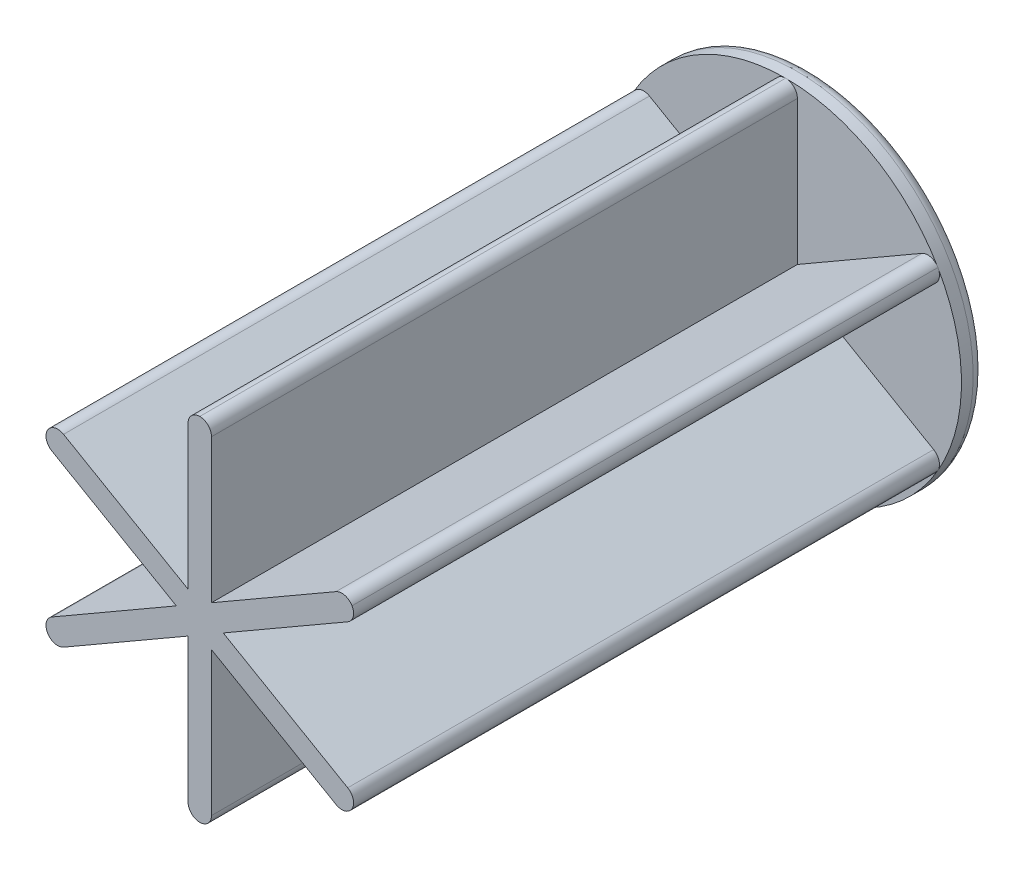
from build123d import *
from build123d.topology import SkipClean

# Parameters (mm, degrees)
SKETCH1_R           = 15
BOSS_EXTRUDE1_DEPTH = 2
BOSS_EXTRUDE2_DEPTH = 50
CIRPATTERN1_COUNT   = 3
CIRPATTERN1_ANGLE   = 120
CUT_EXTRUDE1_DEPTH  = 10
FILLET2_R           = 1
FILLET3_R           = 1


with BuildPart() as part:
    # Sketch1 → Boss-Extrude1 (new body)
    with BuildSketch(Plane.XY):
        Circle(SKETCH1_R)
    extrude(amount=BOSS_EXTRUDE1_DEPTH)

    # Sketch2 → Boss-Extrude2 (add)
    with SkipClean():  # the faces are left unmerged after this step: merging them gives an invalid solid
        with BuildSketch(Plane.XY.offset(2)):
            with BuildLine():
                Line((-1, -14.966629547), (-1, 14.966629547))
                ThreePointArc((-1, 14.966629547), (0, 15), (1, 14.966629547))
                Line((1, 14.966629547), (1, -14.966629547))
                ThreePointArc((1, -14.966629547), (0, -15), (-1, -14.966629547))
            make_face()
        boss_extrude2 = extrude(amount=BOSS_EXTRUDE2_DEPTH)

    # CirPattern1: Boss-Extrude2 ×3 about axis
    with SkipClean():  # the faces are left unmerged after this step: merging them gives an invalid solid
        cirpattern1_axis = Axis((0, 0, 0), (0, 0, 1))
        for i in range(1, CIRPATTERN1_COUNT):
            add(boss_extrude2.rotate(cirpattern1_axis, i * CIRPATTERN1_ANGLE / (CIRPATTERN1_COUNT - 1)))

    # Sketch3 → Cut-Extrude1 (cut)
    with SkipClean():  # the faces are left unmerged after this step: merging them gives an invalid solid
        with BuildSketch(Plane(origin=(0, 0, 0), x_dir=(-1, 0, 0), z_dir=(0, 0, -1))):
            with BuildLine():
                Line((-2.598076211, 1.5), (2.598076211, 1.5))
                ThreePointArc((2.598076211, 1.5), (0, -3), (-2.598076211, 1.5))
            make_face()
        extrude(amount=-CUT_EXTRUDE1_DEPTH, mode=Mode.SUBTRACT)

    # Fillet2
    # the kernel refuses this fillet: 1 mm, written as the material it takes off along each edge
    with BuildSketch(Plane(origin=(12.461481397, 8.349340177, 2), x_dir=(0.5286054177499072, -0.8488676647896573, 0), z_dir=(0, 0, 1)), Plane(origin=(-12.461481397, -8.349340177, 2), x_dir=(-0.5286054177499102, 0.8488676647896556, 0), z_dir=(0, 0, 1)), Plane(origin=(-13.461481397, 6.61728937, 2), x_dir=(0.4708382532840629, 0.882219552744334, 0), z_dir=(0, 0, 1)), Plane(origin=(13.461481397, -6.61728937, 2), x_dir=(-0.47083825328406437, -0.8822195527443331, 0), z_dir=(0, 0, 1)), Plane(origin=(-1, 14.966629547, 2), x_dir=(0.9994436710339702, 0.03335188795467453, 0), z_dir=(0, 0, 1)), Plane(origin=(1, -14.966629547, 2), x_dir=(-0.9994436710339702, -0.03335188795467453, 0), z_dir=(0, 0, 1))) as fillet2_piece_1:
        with BuildLine():
            CenterArc((0.967204751, -0.999443671), FILLET2_R, 88.088723135, 90)
            Line((-0.03223892, -0.966091783), (0, 0))
            ThreePointArc((0, 0), (0.500278319, 0.008344934), (1.000556639, 0))
        make_face()
    extrude(amount=52.501391597, mode=Mode.SUBTRACT)
    with BuildSketch(Plane(origin=(-12.461481397, 8.349340177, 2), x_dir=(-0.5286054177498939, -0.8488676647896658, 0), z_dir=(0, 0, 1)), Plane(origin=(12.461481397, -8.349340177, 2), x_dir=(0.52860541774991, 0.8488676647896555, 0), z_dir=(0, 0, 1)), Plane(origin=(13.461481397, 6.61728937, 2), x_dir=(-0.4708382532840634, 0.8822195527443337, 0), z_dir=(0, 0, 1)), Plane(origin=(-13.461481397, -6.61728937, 2), x_dir=(0.470838253284063, -0.8822195527443338, 0), z_dir=(0, 0, 1)), Plane(origin=(1, 14.966629547, 2), x_dir=(-0.9994436710339702, 0.03335188795467452, 0), z_dir=(0, 0, 1)), Plane(origin=(-1, -14.966629547, 2), x_dir=(0.9994436710339702, -0.03335188795467453, 0), z_dir=(0, 0, 1))) as fillet2_piece_2:
        with BuildLine():
            CenterArc((0.967204751, 0.999443671), FILLET2_R, 181.911276865, 90)
            Line((-0.03223892, 0.966091783), (0, 0))
            ThreePointArc((0, 0), (0.500278319, -0.008344934), (1.000556639, 0))
        make_face()
    extrude(amount=52.501391597, mode=Mode.SUBTRACT)

    # Fillet3
    fillet3_edges = [part.edges().sort_by_distance(p)[0] for p in [
        (-15, 0, 0),
    ]]
    fillet(fillet3_edges, radius=FILLET3_R)


solid = part.part
